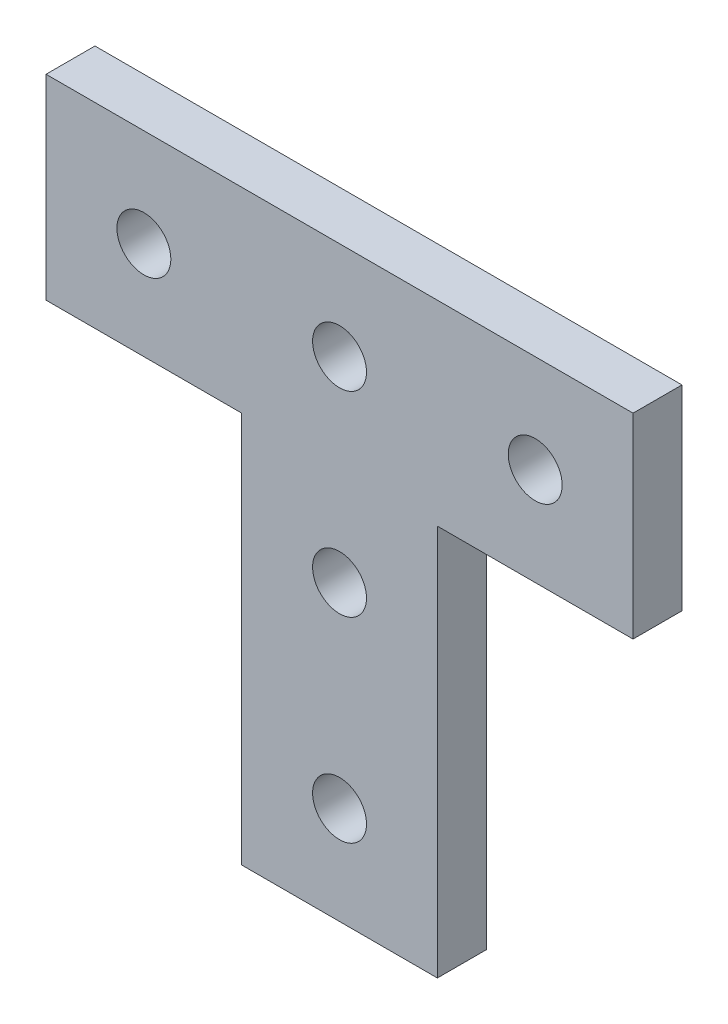
from build123d import *

# Parameters (mm, degrees)
BOSS_EXTRUDE1_DEPTH = 6.35
SKETCH2_R           = 3.5
CUT_EXTRUDE1_DEPTH  = 86.430512699


with BuildPart() as part:
    # Sketch1 → Boss-Extrude1 (new body)
    with BuildSketch(Plane.XY):
        Polygon((12.7, 0), (-12.7, 0), (-12.7, 50.8), (-38.1, 50.8), (-38.1, 76.2), (38.1, 76.2), (38.1, 50.8), (12.7, 50.8), align=None)
    extrude(amount=BOSS_EXTRUDE1_DEPTH)

    # Sketch2 → Cut-Extrude1 (cut, through all)
    with BuildSketch(Plane.XY.offset(6.35)):
        with Locations((0, 63.5)):
            Circle(SKETCH2_R)
        with Locations((25.4, 63.5)):
            Circle(SKETCH2_R)
        with Locations((-25.4, 63.5)):
            Circle(SKETCH2_R)
        with Locations((0, 38.1)):
            Circle(SKETCH2_R)
        with Locations((0, 12.7)):
            Circle(SKETCH2_R)
    extrude(amount=-CUT_EXTRUDE1_DEPTH, mode=Mode.SUBTRACT)


solid = part.part
